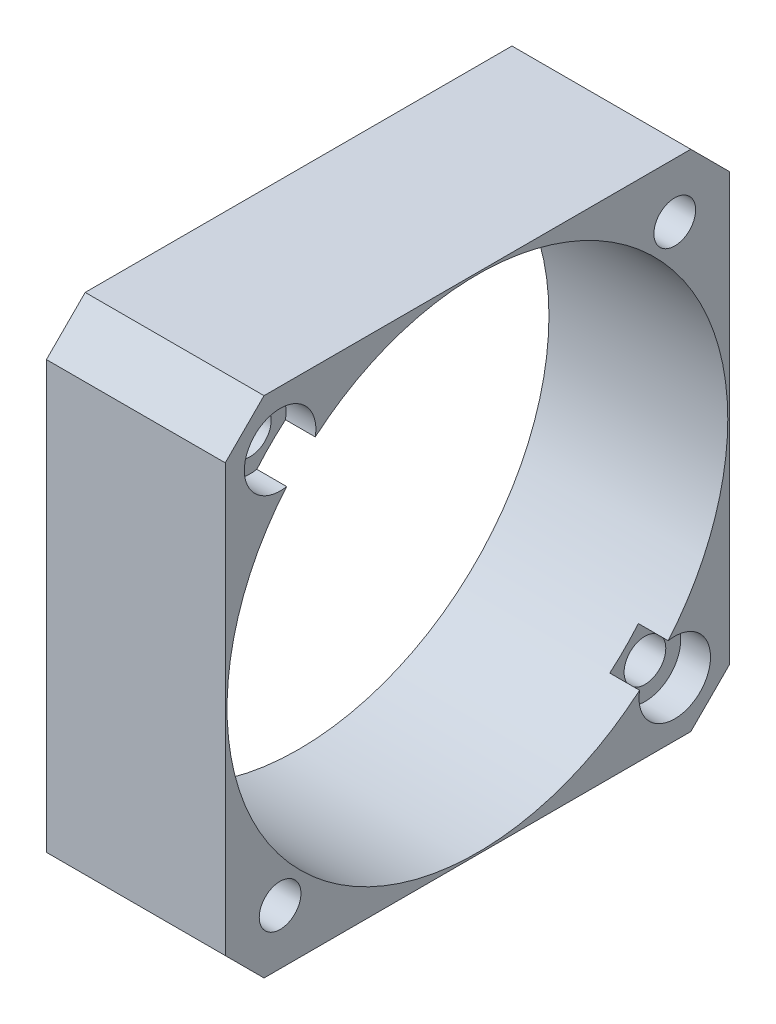
from build123d import *
from build123d.topology import SkipClean

# Parameters (mm, degrees)
BOSS_EXTRUDE1_START     = -10
BOSS_EXTRUDE1_OUTLINE_W = 42.3
BOSS_EXTRUDE1_OUTLINE_H = 42.3
BOSS_EXTRUDE1_DEPTH     = 10
CUT_EXTRUDE1_DEPTH      = 38.645549687
CUT_EXTRUDE1_DEPTH_BACK = 38.645549687
SKETCH2_R               = 1.75
CUT_EXTRUDE2_DEPTH      = 38.645549687
SKETCH4_R               = 18.5
SKETCH4_R_2             = 1.75
BOSS_EXTRUDE2_DEPTH     = 5
SKETCH5_R               = 3
CUT_EXTRUDE3_DEPTH      = 2.5
SKETCH6_R               = 21
CUT_EXTRUDE4_DEPTH      = 40.27069405


with BuildPart() as part:
    # Boss-Extrude1: read off the stored shape, not the designer's step
    # Boss-Extrude1 outline → Boss-Extrude1 (new body)
    with BuildSketch(Plane(origin=(-8.22287786, 0, 0), x_dir=(0, 0, -1), z_dir=(1, 0, 0)).offset(BOSS_EXTRUDE1_START)):
        with Locations((-8.319465315, -0.033437522)):
            Rectangle(BOSS_EXTRUDE1_OUTLINE_W, BOSS_EXTRUDE1_OUTLINE_H)
        with BuildLine():
            ThreePointArc((-8.140312225, 18.091677103), (-7.905501659, 17.531132097), (-7.710167137, 16.95564002))
            ThreePointArc((-7.710167137, 16.95564002), (-7.556763199, 16.949444609), (-7.403421467, 16.941864056))
            ThreePointArc((-7.403421467, 16.941864056), (-7.157286592, 17.497529719), (-6.873174438, 18.034769879))
            ThreePointArc((-6.873174438, 18.034769879), (-6.694663202, 18.019592531), (-6.516310694, 18.002651561))
            ThreePointArc((-6.516310694, 18.002651561), (-6.332692274, 17.423314887), (-6.189730822, 16.832629921))
            ThreePointArc((-6.189730822, 16.832629921), (-6.037499796, 16.812708428), (-5.885454889, 16.791412945))
            ThreePointArc((-5.885454889, 16.791412945), (-5.590501394, 17.322778302), (-5.259375155, 17.832388074))
            ThreePointArc((-5.259375155, 17.832388074), (-5.08294304, 17.801270201), (-4.906827104, 17.768410035))
            ThreePointArc((-4.906827104, 17.768410035), (-4.775879216, 17.174946172), (-4.686441878, 16.573824164))
            ThreePointArc((-4.686441878, 16.573824164), (-4.536609438, 16.540336985), (-4.387085531, 16.505498031))
            ThreePointArc((-4.387085531, 16.505498031), (-4.045688209, 17.008284839), (-3.670213919, 17.486161145))
            ThreePointArc((-3.670213919, 17.486161145), (-3.497281452, 17.439353291), (-3.32482007, 17.390838499))
            ThreePointArc((-3.32482007, 17.390838499), (-3.24759703, 16.788025669), (-3.212403902, 16.181306501))
            ThreePointArc((-3.212403902, 16.181306501), (-3.066176411, 16.134523255), (-2.920377383, 16.086421333))
            ThreePointArc((-2.920377383, 16.086421333), (-2.535284964, 16.556581449), (-2.118485721, 16.998876709))
            ThreePointArc((-2.118485721, 16.998876709), (-1.950445253, 16.936755743), (-1.783026982, 16.872976939))
            ThreePointArc((-1.783026982, 16.872976939), (-1.760150546, 16.265668636), (-1.779484981, 15.658237253))
            ThreePointArc((-1.779484981, 15.658237253), (-1.638039777, 15.598534611), (-1.497139516, 15.537557009))
            ThreePointArc((-1.497139516, 15.537557009), (-1.071452538, 15.971304981), (-0.616684165, 16.374458094))
            ThreePointArc((-0.616684165, 16.374458094), (-0.454888659, 16.297524177), (-0.293861453, 16.21899487))
            ThreePointArc((-0.293861453, 16.21899487), (-0.325515807, 15.612080784), (-0.399222137, 15.008827866))
            ThreePointArc((-0.399222137, 15.008827866), (-0.263698053, 14.936686519), (-0.128831005, 14.863324193))
            ThreePointArc((-0.128831005, 14.863324193), (0.33402315, 15.257167737), (0.823099126, 15.617932752))
            ThreePointArc((0.823099126, 15.617932752), (0.977346988, 15.526805311), (1.130686633, 15.434157772))
            ThreePointArc((1.130686633, 15.434157772), (1.044756351, 14.832524418), (0.917271566, 14.238307003))
            ThreePointArc((0.917271566, 14.238307003), (1.04578337, 14.154307791), (1.173531334, 14.069151411))
            ThreePointArc((1.173531334, 14.069151411), (1.669826038, 14.41991953), (2.189271864, 14.735391778))
            ThreePointArc((2.189271864, 14.735391778), (2.334730168, 14.630804518), (2.479147652, 14.524784691))
            ThreePointArc((2.479147652, 14.524784691), (2.339633302, 13.933276067), (2.159396495, 13.352878445))
            ThreePointArc((2.159396495, 13.352878445), (2.279861317, 13.25769768), (2.399461646, 13.161432875))
            ThreePointArc((2.399461646, 13.161432875), (2.925201025, 13.46630139), (3.47083443, 13.733940875))
            ThreePointArc((3.47083443, 13.733940875), (3.606332032, 13.616735871), (3.740664589, 13.498197365))
            ThreePointArc((3.740664589, 13.498197365), (3.548689459, 12.921575951), (3.31715179, 12.359671142))
            ThreePointArc((3.31715179, 12.359671142), (3.428599718, 12.254075163), (3.539089461, 12.147477001))
            ThreePointArc((3.539089461, 12.147477001), (4.090040571, 12.403991291), (4.657468434, 12.621643137))
            ThreePointArc((4.657468434, 12.621643137), (4.781914387, 12.492764053), (4.905080451, 12.362661271))
            ThreePointArc((4.905080451, 12.362661271), (4.662190211, 11.805569683), (4.381215887, 11.266681815))
            ThreePointArc((4.381215887, 11.266681815), (4.482749607, 11.151520819), (4.583239166, 11.035447566))
            ThreePointArc((4.583239166, 11.035447566), (5.154966072, 11.241542328), (5.739619798, 11.40745413))
            ThreePointArc((5.739619798, 11.40745413), (5.852012136, 11.267938627), (5.963020047, 11.127319079))
            ThreePointArc((5.963020047, 11.127319079), (5.671170307, 10.594242691), (5.343021566, 10.082710571))
            ThreePointArc((5.343021566, 10.082710571), (5.43382359, 9.958911767), (5.52350388, 9.834297976))
            ThreePointArc((5.52350388, 9.834297976), (6.111403374, 9.988313856), (6.708575676, 10.10114979))
            ThreePointArc((6.708575676, 10.10114979), (6.808009482, 9.952121164), (6.905965468, 9.802117037))
            ThreePointArc((6.905965468, 9.802117037), (6.56750603, 9.297347867), (6.194824934, 8.817290051))
            ThreePointArc((6.194824934, 8.817290051), (6.274164177, 8.685850194), (6.352313147, 8.553699182))
            ThreePointArc((6.352313147, 8.553699182), (6.951651807, 8.654396135), (7.556534604, 8.713247712))
            ThreePointArc((7.556534604, 8.713247712), (7.642209296, 8.555905854), (7.726324673, 8.397724892))
            ThreePointArc((7.726324673, 8.397724892), (7.343980614, 7.925327045), (6.929767772, 7.480608677))
            ThreePointArc((6.929767772, 7.480608677), (6.99700544, 7.342586043), (7.06299388, 7.203961813))
            ThreePointArc((7.06299388, 7.203961813), (7.668946184, 7.250529086), (8.276669315, 7.254922468))
            ThreePointArc((8.276669315, 7.254922468), (8.347895091, 7.090534202), (8.417492612, 6.925449986))
            ThreePointArc((8.417492612, 6.925449986), (7.994342341, 6.48922693), (7.541932751, 6.08342862))
            ThreePointArc((7.541932751, 6.08342862), (7.596527486, 5.939934487), (7.649824096, 5.795953159))
            ThreePointArc((7.649824096, 5.795953159), (8.257511273, 5.788015821), (8.863181709, 5.737915635))
            ThreePointArc((8.863181709, 5.737915635), (8.9193851, 5.567804518), (8.973904407, 5.397146209))
            ThreePointArc((8.973904407, 5.397146209), (8.513354882, 5.000610157), (8.026391079, 4.636999155))
            ThreePointArc((8.026391079, 4.636999155), (8.067903317, 4.489188853), (8.108078984, 4.34100968))
            ThreePointArc((8.108078984, 4.34100968), (8.712608293, 4.278631636), (9.311349532, 4.17444126))
            ThreePointArc((9.311349532, 4.17444126), (9.352078022, 3.999976927), (9.391080158, 3.825118565))
            ThreePointArc((9.391080158, 3.825118565), (8.896839451, 3.471462192), (8.379242183, 3.152966079))
            ThreePointArc((8.379242183, 3.152966079), (8.407337692, 3.00202969), (8.434068944, 2.850845724))
            ThreePointArc((8.434068944, 2.850845724), (9.030573071, 2.734529206), (9.617564401, 2.577087519))
            ThreePointArc((9.617564401, 2.577087519), (9.642490067, 2.399674654), (9.665661009, 2.222024096))
            ThreePointArc((9.665661009, 2.222024096), (9.141708458, 1.914094835), (8.597645113, 1.643277956))
            ThreePointArc((8.597645113, 1.643277956), (8.612097683, 1.49043073), (8.625169297, 1.337459215))
            ThreePointArc((8.625169297, 1.337459215), (9.208845542, 1.168140735), (9.779360853, 0.958715365))
            ThreePointArc((9.779360853, 0.958715365), (9.788283009, 0.779782393), (9.795436199, 0.600769976))
            ThreePointArc((9.795436199, 0.600769976), (9.24599036, 0.341047093), (8.679841416, 0.120089905))
            ThreePointArc((8.679841416, 0.120089905), (8.680534685, -0.033437522), (8.679841416, -0.186964949))
            ThreePointArc((8.679841416, -0.186964949), (9.24599036, -0.407922137), (9.795436199, -0.667645021))
            ThreePointArc((9.795436199, -0.667645021), (9.788283009, -0.846657437), (9.779360853, -1.025590409))
            ThreePointArc((9.779360853, -1.025590409), (9.208845542, -1.23501578), (8.625169297, -1.404334259))
            ThreePointArc((8.625169297, -1.404334259), (8.612097683, -1.557305774), (8.597645113, -1.710153))
            ThreePointArc((8.597645113, -1.710153), (9.141708458, -1.980969879), (9.665661009, -2.28889914))
            ThreePointArc((9.665661009, -2.28889914), (9.642490067, -2.466549698), (9.617564401, -2.643962563))
            ThreePointArc((9.617564401, -2.643962563), (9.030573071, -2.80140425), (8.434068944, -2.917720768))
            ThreePointArc((8.434068944, -2.917720768), (8.407337692, -3.068904734), (8.379242183, -3.219841124))
            ThreePointArc((8.379242183, -3.219841124), (8.896839451, -3.538337236), (9.391080158, -3.891993609))
            ThreePointArc((9.391080158, -3.891993609), (9.352078022, -4.066851971), (9.311349532, -4.241316304))
            ThreePointArc((9.311349532, -4.241316304), (8.712608293, -4.34550668), (8.108078984, -4.407884724))
            ThreePointArc((8.108078984, -4.407884724), (8.067903317, -4.556063897), (8.026391079, -4.703874199))
            ThreePointArc((8.026391079, -4.703874199), (8.513354882, -5.067485201), (8.973904407, -5.464021253))
            ThreePointArc((8.973904407, -5.464021253), (8.9193851, -5.634679562), (8.863181709, -5.804790679))
            ThreePointArc((8.863181709, -5.804790679), (8.257511273, -5.854890865), (7.649824096, -5.862828204))
            ThreePointArc((7.649824096, -5.862828204), (7.596527486, -6.006809532), (7.541932751, -6.150303665))
            ThreePointArc((7.541932751, -6.150303665), (7.994342341, -6.556101975), (8.417492612, -6.99232503))
            ThreePointArc((8.417492612, -6.99232503), (8.347895091, -7.157409246), (8.276669315, -7.321797513))
            ThreePointArc((8.276669315, -7.321797513), (7.668946184, -7.31740413), (7.06299388, -7.270836857))
            ThreePointArc((7.06299388, -7.270836857), (6.99700544, -7.409461087), (6.929767772, -7.547483721))
            ThreePointArc((6.929767772, -7.547483721), (7.343980614, -7.992202089), (7.726324673, -8.464599937))
            ThreePointArc((7.726324673, -8.464599937), (7.642209296, -8.622780898), (7.556534604, -8.780122757))
            ThreePointArc((7.556534604, -8.780122757), (6.951651807, -8.721271179), (6.352313147, -8.620574226))
            ThreePointArc((6.352313147, -8.620574226), (6.274164177, -8.752725238), (6.194824934, -8.884165095))
            ThreePointArc((6.194824934, -8.884165095), (6.56750603, -9.364222911), (6.905965468, -9.868992081))
            ThreePointArc((6.905965468, -9.868992081), (6.808009482, -10.018996208), (6.708575676, -10.168024834))
            ThreePointArc((6.708575676, -10.168024834), (6.111403374, -10.0551889), (5.52350388, -9.90117302))
            ThreePointArc((5.52350388, -9.90117302), (5.43382359, -10.025786811), (5.343021566, -10.149585615))
            ThreePointArc((5.343021566, -10.149585615), (5.671170307, -10.661117735), (5.963020047, -11.194194123))
            ThreePointArc((5.963020047, -11.194194123), (5.852012137, -11.334813671), (5.739619798, -11.474329174))
            ThreePointArc((5.739619798, -11.474329174), (5.154966072, -11.308417372), (4.583239166, -11.10232261))
            ThreePointArc((4.583239166, -11.10232261), (4.482749607, -11.218395863), (4.381215887, -11.333556859))
            ThreePointArc((4.381215887, -11.333556859), (4.662190211, -11.872444727), (4.905080451, -12.429536315))
            ThreePointArc((4.905080451, -12.429536315), (4.781914387, -12.559639098), (4.657468434, -12.688518181))
            ThreePointArc((4.657468434, -12.688518181), (4.090040571, -12.470866335), (3.539089461, -12.214352046))
            ThreePointArc((3.539089461, -12.214352046), (3.428599718, -12.320950207), (3.31715179, -12.426546186))
            ThreePointArc((3.31715179, -12.426546186), (3.548689459, -12.988450995), (3.740664589, -13.565072409))
            ThreePointArc((3.740664589, -13.565072409), (3.606332032, -13.683610915), (3.47083443, -13.80081592))
            ThreePointArc((3.47083443, -13.80081592), (2.925201025, -13.533176435), (2.399461646, -13.22830792))
            ThreePointArc((2.399461646, -13.22830792), (2.279861317, -13.324572724), (2.159396495, -13.419753489))
            ThreePointArc((2.159396495, -13.419753489), (2.339633302, -14.000151111), (2.479147652, -14.591659735))
            ThreePointArc((2.479147652, -14.591659735), (2.334730168, -14.697679562), (2.189271864, -14.802266823))
            ThreePointArc((2.189271864, -14.802266823), (1.669826038, -14.486794574), (1.173531334, -14.136026456))
            ThreePointArc((1.173531334, -14.136026456), (1.04578337, -14.221182835), (0.917271566, -14.305182047))
            ThreePointArc((0.917271566, -14.305182047), (1.044756351, -14.899399462), (1.130686633, -15.501032816))
            ThreePointArc((1.130686633, -15.501032816), (0.977346988, -15.593680355), (0.823099126, -15.684807796))
            ThreePointArc((0.823099126, -15.684807796), (0.33402315, -15.324042781), (-0.128831005, -14.930199238))
            ThreePointArc((-0.128831005, -14.930199238), (-0.263698052, -15.003561564), (-0.399222137, -15.07570291))
            ThreePointArc((-0.399222137, -15.07570291), (-0.325515807, -15.678955828), (-0.293861453, -16.285869914))
            ThreePointArc((-0.293861453, -16.285869914), (-0.454888659, -16.364399222), (-0.616684165, -16.441333139))
            ThreePointArc((-0.616684165, -16.441333139), (-1.071452538, -16.038180025), (-1.497139516, -15.604432053))
            ThreePointArc((-1.497139516, -15.604432053), (-1.638039777, -15.665409655), (-1.779484981, -15.725112297))
            ThreePointArc((-1.779484981, -15.725112297), (-1.760150546, -16.33254368), (-1.783026982, -16.939851983))
            ThreePointArc((-1.783026982, -16.939851983), (-1.950445253, -17.003630787), (-2.118485721, -17.065751754))
            ThreePointArc((-2.118485721, -17.065751754), (-2.535284964, -16.623456494), (-2.920377383, -16.153296377))
            ThreePointArc((-2.920377383, -16.153296377), (-3.066176411, -16.201398299), (-3.212403902, -16.248181545))
            ThreePointArc((-3.212403902, -16.248181545), (-3.24759703, -16.854900714), (-3.32482007, -17.457713544))
            ThreePointArc((-3.32482007, -17.457713544), (-3.497281452, -17.506228335), (-3.670213919, -17.553036189))
            ThreePointArc((-3.670213919, -17.553036189), (-4.045688209, -17.075159884), (-4.387085531, -16.572373075))
            ThreePointArc((-4.387085531, -16.572373075), (-4.536609438, -16.607212029), (-4.686441878, -16.640699208))
            ThreePointArc((-4.686441878, -16.640699208), (-4.775879216, -17.241821216), (-4.906827104, -17.835285079))
            ThreePointArc((-4.906827104, -17.835285079), (-5.08294304, -17.868145245), (-5.259375155, -17.899263118))
            ThreePointArc((-5.259375155, -17.899263118), (-5.590501394, -17.389653346), (-5.885454889, -16.858287989))
            ThreePointArc((-5.885454889, -16.858287989), (-6.037499796, -16.879583472), (-6.189730822, -16.899504965))
            ThreePointArc((-6.189730822, -16.899504965), (-6.332692274, -17.490189931), (-6.516310694, -18.069526605))
            ThreePointArc((-6.516310694, -18.069526605), (-6.694663202, -18.086467575), (-6.873174438, -18.101644923))
            ThreePointArc((-6.873174438, -18.101644923), (-7.157286592, -17.564404763), (-7.403421467, -17.0087391))
            ThreePointArc((-7.403421467, -17.0087391), (-7.556763199, -17.016319653), (-7.710167137, -17.022515064))
            ThreePointArc((-7.710167137, -17.022515064), (-7.905501659, -17.598007141), (-8.140312225, -18.158552147))
            ThreePointArc((-8.140312225, -18.158552147), (-8.319465315, -18.159437522), (-8.498618404, -18.158552147))
            ThreePointArc((-8.498618404, -18.158552147), (-8.73342897, -17.598007141), (-8.928763492, -17.022515064))
            ThreePointArc((-8.928763492, -17.022515064), (-9.08216743, -17.016319653), (-9.235509162, -17.0087391))
            ThreePointArc((-9.235509162, -17.0087391), (-9.481644037, -17.564404763), (-9.765756192, -18.101644923))
            ThreePointArc((-9.765756192, -18.101644923), (-9.944267428, -18.086467575), (-10.122619935, -18.069526605))
            ThreePointArc((-10.122619935, -18.069526605), (-10.306238356, -17.490189931), (-10.449199807, -16.899504965))
            ThreePointArc((-10.449199807, -16.899504965), (-10.601430834, -16.879583472), (-10.753475741, -16.858287989))
            ThreePointArc((-10.753475741, -16.858287989), (-11.048429235, -17.389653346), (-11.379555474, -17.899263118))
            ThreePointArc((-11.379555474, -17.899263118), (-11.555987589, -17.868145245), (-11.732103525, -17.835285079))
            ThreePointArc((-11.732103525, -17.835285079), (-11.863051413, -17.241821216), (-11.952488751, -16.640699208))
            ThreePointArc((-11.952488751, -16.640699208), (-12.102321192, -16.607212029), (-12.251845099, -16.572373075))
            ThreePointArc((-12.251845099, -16.572373075), (-12.59324242, -17.075159884), (-12.96871671, -17.553036189))
            ThreePointArc((-12.96871671, -17.553036189), (-13.141649177, -17.506228335), (-13.31411056, -17.457713544))
            ThreePointArc((-13.31411056, -17.457713544), (-13.391333599, -16.854900714), (-13.426526727, -16.248181545))
            ThreePointArc((-13.426526727, -16.248181545), (-13.572754219, -16.201398299), (-13.718553247, -16.153296377))
            ThreePointArc((-13.718553247, -16.153296377), (-14.103645665, -16.623456494), (-14.520444908, -17.065751754))
            ThreePointArc((-14.520444908, -17.065751754), (-14.688485376, -17.003630787), (-14.855903647, -16.939851983))
            ThreePointArc((-14.855903647, -16.939851983), (-14.878780084, -16.33254368), (-14.859445648, -15.725112297))
            ThreePointArc((-14.859445648, -15.725112297), (-15.000890853, -15.665409655), (-15.141791113, -15.604432053))
            ThreePointArc((-15.141791113, -15.604432053), (-15.567478091, -16.038180025), (-16.022246464, -16.441333139))
            ThreePointArc((-16.022246464, -16.441333139), (-16.18404197, -16.364399222), (-16.345069176, -16.285869914))
            ThreePointArc((-16.345069176, -16.285869914), (-16.313414823, -15.678955828), (-16.239708492, -15.07570291))
            ThreePointArc((-16.239708492, -15.07570291), (-16.375232577, -15.003561564), (-16.510099624, -14.930199238))
            ThreePointArc((-16.510099624, -14.930199238), (-16.97295378, -15.324042781), (-17.462029755, -15.684807796))
            ThreePointArc((-17.462029755, -15.684807796), (-17.616277617, -15.593680355), (-17.769617262, -15.501032816))
            ThreePointArc((-17.769617262, -15.501032816), (-17.68368698, -14.899399462), (-17.556202195, -14.305182047))
            ThreePointArc((-17.556202195, -14.305182047), (-17.684713999, -14.221182835), (-17.812461963, -14.136026456))
            ThreePointArc((-17.812461963, -14.136026456), (-18.308756667, -14.486794574), (-18.828202493, -14.802266823))
            ThreePointArc((-18.828202493, -14.802266823), (-18.973660797, -14.697679562), (-19.118078281, -14.591659735))
            ThreePointArc((-19.118078281, -14.591659735), (-18.978563932, -14.000151111), (-18.798327124, -13.419753489))
            ThreePointArc((-18.798327124, -13.419753489), (-18.918791946, -13.324572724), (-19.038392276, -13.22830792))
            ThreePointArc((-19.038392276, -13.22830792), (-19.564131655, -13.533176435), (-20.109765059, -13.80081592))
            ThreePointArc((-20.109765059, -13.80081592), (-20.245262661, -13.683610915), (-20.379595218, -13.565072409))
            ThreePointArc((-20.379595218, -13.565072409), (-20.187620088, -12.988450995), (-19.956082419, -12.426546186))
            ThreePointArc((-19.956082419, -12.426546186), (-20.067530347, -12.320950207), (-20.17802009, -12.214352046))
            ThreePointArc((-20.17802009, -12.214352046), (-20.7289712, -12.470866335), (-21.296399063, -12.688518181))
            ThreePointArc((-21.296399063, -12.688518181), (-21.420845016, -12.559639098), (-21.54401108, -12.429536315))
            ThreePointArc((-21.54401108, -12.429536315), (-21.301120841, -11.872444727), (-21.020146516, -11.333556859))
            ThreePointArc((-21.020146516, -11.333556859), (-21.121680237, -11.218395863), (-21.222169795, -11.10232261))
            ThreePointArc((-21.222169795, -11.10232261), (-21.793896701, -11.308417372), (-22.378550428, -11.474329174))
            ThreePointArc((-22.378550428, -11.474329174), (-22.490942766, -11.334813671), (-22.601950676, -11.194194123))
            ThreePointArc((-22.601950676, -11.194194123), (-22.310100936, -10.661117735), (-21.981952195, -10.149585615))
            ThreePointArc((-21.981952195, -10.149585615), (-22.072754219, -10.025786811), (-22.16243451, -9.90117302))
            ThreePointArc((-22.16243451, -9.90117302), (-22.750334003, -10.0551889), (-23.347506305, -10.168024834))
            ThreePointArc((-23.347506305, -10.168024834), (-23.446940112, -10.018996208), (-23.544896097, -9.868992081))
            ThreePointArc((-23.544896097, -9.868992081), (-23.20643666, -9.364222911), (-22.833755564, -8.884165095))
            ThreePointArc((-22.833755564, -8.884165095), (-22.913094806, -8.752725238), (-22.991243776, -8.620574226))
            ThreePointArc((-22.991243776, -8.620574226), (-23.590582436, -8.721271179), (-24.195465233, -8.780122757))
            ThreePointArc((-24.195465233, -8.780122757), (-24.281139925, -8.622780898), (-24.365255303, -8.464599937))
            ThreePointArc((-24.365255303, -8.464599937), (-23.982911244, -7.992202089), (-23.568698401, -7.547483721))
            ThreePointArc((-23.568698401, -7.547483721), (-23.635936069, -7.409461087), (-23.701924509, -7.270836857))
            ThreePointArc((-23.701924509, -7.270836857), (-24.307876813, -7.31740413), (-24.915599944, -7.321797513))
            ThreePointArc((-24.915599944, -7.321797513), (-24.98682572, -7.157409246), (-25.056423242, -6.99232503))
            ThreePointArc((-25.056423242, -6.99232503), (-24.633272971, -6.556101975), (-24.18086338, -6.150303665))
            ThreePointArc((-24.18086338, -6.150303665), (-24.235458116, -6.006809532), (-24.288754725, -5.862828204))
            ThreePointArc((-24.288754725, -5.862828204), (-24.896441902, -5.854890865), (-25.502112338, -5.804790679))
            ThreePointArc((-25.502112338, -5.804790679), (-25.558315729, -5.634679562), (-25.612835037, -5.464021253))
            ThreePointArc((-25.612835037, -5.464021253), (-25.152285511, -5.067485201), (-24.665321708, -4.703874199))
            ThreePointArc((-24.665321708, -4.703874199), (-24.706833946, -4.556063897), (-24.747009613, -4.407884724))
            ThreePointArc((-24.747009613, -4.407884724), (-25.351538922, -4.34550668), (-25.950280161, -4.241316304))
            ThreePointArc((-25.950280161, -4.241316304), (-25.991008651, -4.066851971), (-26.030010787, -3.891993609))
            ThreePointArc((-26.030010787, -3.891993609), (-25.535770081, -3.538337236), (-25.018172812, -3.219841124))
            ThreePointArc((-25.018172812, -3.219841124), (-25.046268321, -3.068904734), (-25.072999573, -2.917720768))
            ThreePointArc((-25.072999573, -2.917720768), (-25.6695037, -2.80140425), (-26.25649503, -2.643962563))
            ThreePointArc((-26.25649503, -2.643962563), (-26.281420696, -2.466549698), (-26.304591639, -2.28889914))
            ThreePointArc((-26.304591639, -2.28889914), (-25.780639087, -1.980969879), (-25.236575742, -1.710153))
            ThreePointArc((-25.236575742, -1.710153), (-25.251028313, -1.557305774), (-25.264099927, -1.404334259))
            ThreePointArc((-25.264099927, -1.404334259), (-25.847776171, -1.23501578), (-26.418291482, -1.025590409))
            ThreePointArc((-26.418291482, -1.025590409), (-26.427213639, -0.846657437), (-26.434366828, -0.667645021))
            ThreePointArc((-26.434366828, -0.667645021), (-25.884920989, -0.407922137), (-25.318772045, -0.186964949))
            ThreePointArc((-25.318772045, -0.186964949), (-25.319465315, -0.033437522), (-25.318772045, 0.120089905))
            ThreePointArc((-25.318772045, 0.120089905), (-25.884920989, 0.341047093), (-26.434366828, 0.600769976))
            ThreePointArc((-26.434366828, 0.600769976), (-26.427213639, 0.779782393), (-26.418291482, 0.958715365))
            ThreePointArc((-26.418291482, 0.958715365), (-25.847776171, 1.168140735), (-25.264099927, 1.337459215))
            ThreePointArc((-25.264099927, 1.337459215), (-25.251028313, 1.49043073), (-25.236575742, 1.643277956))
            ThreePointArc((-25.236575742, 1.643277956), (-25.780639087, 1.914094835), (-26.304591639, 2.222024096))
            ThreePointArc((-26.304591639, 2.222024096), (-26.281420696, 2.399674654), (-26.25649503, 2.577087519))
            ThreePointArc((-26.25649503, 2.577087519), (-25.6695037, 2.734529206), (-25.072999573, 2.850845724))
            ThreePointArc((-25.072999573, 2.850845724), (-25.046268321, 3.00202969), (-25.018172812, 3.152966079))
            ThreePointArc((-25.018172812, 3.152966079), (-25.535770081, 3.471462192), (-26.030010787, 3.825118565))
            ThreePointArc((-26.030010787, 3.825118565), (-25.991008651, 3.999976927), (-25.950280161, 4.17444126))
            ThreePointArc((-25.950280161, 4.17444126), (-25.351538922, 4.278631636), (-24.747009613, 4.34100968))
            ThreePointArc((-24.747009613, 4.34100968), (-24.706833946, 4.489188853), (-24.665321708, 4.636999155))
            ThreePointArc((-24.665321708, 4.636999155), (-25.152285511, 5.000610157), (-25.612835037, 5.397146209))
            ThreePointArc((-25.612835037, 5.397146209), (-25.558315729, 5.567804518), (-25.502112338, 5.737915635))
            ThreePointArc((-25.502112338, 5.737915635), (-24.896441902, 5.788015821), (-24.288754725, 5.795953159))
            ThreePointArc((-24.288754725, 5.795953159), (-24.235458116, 5.939934487), (-24.18086338, 6.08342862))
            ThreePointArc((-24.18086338, 6.08342862), (-24.633272971, 6.48922693), (-25.056423242, 6.925449986))
            ThreePointArc((-25.056423242, 6.925449986), (-24.98682572, 7.090534202), (-24.915599944, 7.254922468))
            ThreePointArc((-24.915599944, 7.254922468), (-24.307876813, 7.250529086), (-23.701924509, 7.203961813))
            ThreePointArc((-23.701924509, 7.203961813), (-23.635936069, 7.342586043), (-23.568698401, 7.480608677))
            ThreePointArc((-23.568698401, 7.480608677), (-23.982911244, 7.925327045), (-24.365255303, 8.397724892))
            ThreePointArc((-24.365255303, 8.397724892), (-24.281139925, 8.555905853), (-24.195465233, 8.713247712))
            ThreePointArc((-24.195465233, 8.713247712), (-23.590582436, 8.654396135), (-22.991243776, 8.553699182))
            ThreePointArc((-22.991243776, 8.553699182), (-22.913094806, 8.685850194), (-22.833755564, 8.817290051))
            ThreePointArc((-22.833755564, 8.817290051), (-23.20643666, 9.297347867), (-23.544896097, 9.802117037))
            ThreePointArc((-23.544896097, 9.802117037), (-23.446940112, 9.952121164), (-23.347506305, 10.10114979))
            ThreePointArc((-23.347506305, 10.10114979), (-22.750334003, 9.988313856), (-22.16243451, 9.834297976))
            ThreePointArc((-22.16243451, 9.834297976), (-22.072754219, 9.958911767), (-21.981952195, 10.082710571))
            ThreePointArc((-21.981952195, 10.082710571), (-22.310100936, 10.594242691), (-22.601950676, 11.127319079))
            ThreePointArc((-22.601950676, 11.127319079), (-22.490942766, 11.267938626), (-22.378550428, 11.40745413))
            ThreePointArc((-22.378550428, 11.40745413), (-21.793896701, 11.241542328), (-21.222169795, 11.035447566))
            ThreePointArc((-21.222169795, 11.035447566), (-21.121680237, 11.151520819), (-21.020146516, 11.266681815))
            ThreePointArc((-21.020146516, 11.266681815), (-21.301120841, 11.805569683), (-21.54401108, 12.362661271))
            ThreePointArc((-21.54401108, 12.362661271), (-21.420845016, 12.492764053), (-21.296399063, 12.621643137))
            ThreePointArc((-21.296399063, 12.621643137), (-20.7289712, 12.403991291), (-20.17802009, 12.147477001))
            ThreePointArc((-20.17802009, 12.147477001), (-20.067530347, 12.254075163), (-19.956082419, 12.359671142))
            ThreePointArc((-19.956082419, 12.359671142), (-20.187620088, 12.921575951), (-20.379595218, 13.498197365))
            ThreePointArc((-20.379595218, 13.498197365), (-20.245262661, 13.616735871), (-20.109765059, 13.733940875))
            ThreePointArc((-20.109765059, 13.733940875), (-19.564131655, 13.46630139), (-19.038392276, 13.161432875))
            ThreePointArc((-19.038392276, 13.161432875), (-18.918791946, 13.25769768), (-18.798327124, 13.352878445))
            ThreePointArc((-18.798327124, 13.352878445), (-18.978563932, 13.933276067), (-19.118078281, 14.524784691))
            ThreePointArc((-19.118078281, 14.524784691), (-18.973660798, 14.630804518), (-18.828202493, 14.735391778))
            ThreePointArc((-18.828202493, 14.735391778), (-18.308756667, 14.41991953), (-17.812461963, 14.069151411))
            ThreePointArc((-17.812461963, 14.069151411), (-17.684713999, 14.154307791), (-17.556202195, 14.238307003))
            ThreePointArc((-17.556202195, 14.238307003), (-17.683686981, 14.832524418), (-17.769617262, 15.434157772))
            ThreePointArc((-17.769617262, 15.434157772), (-17.616277617, 15.526805311), (-17.462029755, 15.617932752))
            ThreePointArc((-17.462029755, 15.617932752), (-16.97295378, 15.257167737), (-16.510099624, 14.863324193))
            ThreePointArc((-16.510099624, 14.863324193), (-16.375232577, 14.936686519), (-16.239708492, 15.008827866))
            ThreePointArc((-16.239708492, 15.008827866), (-16.313414823, 15.612080784), (-16.345069176, 16.21899487))
            ThreePointArc((-16.345069176, 16.21899487), (-16.18404197, 16.297524177), (-16.022246464, 16.374458094))
            ThreePointArc((-16.022246464, 16.374458094), (-15.567478091, 15.971304981), (-15.141791113, 15.537557009))
            ThreePointArc((-15.141791113, 15.537557009), (-15.000890853, 15.598534611), (-14.859445648, 15.658237253))
            ThreePointArc((-14.859445648, 15.658237253), (-14.878780084, 16.265668636), (-14.855903647, 16.872976939))
            ThreePointArc((-14.855903647, 16.872976939), (-14.688485376, 16.936755743), (-14.520444908, 16.998876709))
            ThreePointArc((-14.520444908, 16.998876709), (-14.103645665, 16.556581449), (-13.718553247, 16.086421333))
            ThreePointArc((-13.718553247, 16.086421333), (-13.572754219, 16.134523255), (-13.426526727, 16.181306501))
            ThreePointArc((-13.426526727, 16.181306501), (-13.391333599, 16.788025669), (-13.31411056, 17.390838499))
            ThreePointArc((-13.31411056, 17.390838499), (-13.141649177, 17.439353291), (-12.96871671, 17.486161145))
            ThreePointArc((-12.96871671, 17.486161145), (-12.59324242, 17.008284839), (-12.251845099, 16.505498031))
            ThreePointArc((-12.251845099, 16.505498031), (-12.102321192, 16.540336985), (-11.952488751, 16.573824164))
            ThreePointArc((-11.952488751, 16.573824164), (-11.863051413, 17.174946172), (-11.732103525, 17.768410035))
            ThreePointArc((-11.732103525, 17.768410035), (-11.555987589, 17.801270201), (-11.379555474, 17.832388074))
            ThreePointArc((-11.379555474, 17.832388074), (-11.048429235, 17.322778302), (-10.753475741, 16.791412945))
            ThreePointArc((-10.753475741, 16.791412945), (-10.601430834, 16.812708428), (-10.449199807, 16.832629921))
            ThreePointArc((-10.449199807, 16.832629921), (-10.306238356, 17.423314887), (-10.122619935, 18.002651561))
            ThreePointArc((-10.122619935, 18.002651561), (-9.944267428, 18.019592531), (-9.765756192, 18.034769879))
            ThreePointArc((-9.765756192, 18.034769879), (-9.481644037, 17.497529719), (-9.235509162, 16.941864056))
            ThreePointArc((-9.235509162, 16.941864056), (-9.08216743, 16.949444609), (-8.928763492, 16.95564002))
            ThreePointArc((-8.928763492, 16.95564002), (-8.73342897, 17.531132097), (-8.498618404, 18.091677103))
            ThreePointArc((-8.498618404, 18.091677103), (-8.319465315, 18.092562478), (-8.140312225, 18.091677103))
        make_face(mode=Mode.SUBTRACT)
    extrude(amount=BOSS_EXTRUDE1_DEPTH)

    # Sketch2 → Cut-Extrude1 (cut, two sides: drawn at the far end of the back side and taken through both)
    with BuildSketch(Plane(origin=(-8.22287786, 0, 0), x_dir=(0, 0, -1), z_dir=(1, 0, 0)).offset(-CUT_EXTRUDE1_DEPTH_BACK)):
        with Locations((-24.869465315, 16.516562478)):
            Circle(SKETCH2_R)
        with Locations((8.230534685, 16.516562478)):
            Circle(SKETCH2_R)
        with Locations((8.230534685, -16.583437522)):
            Circle(SKETCH2_R)
        with Locations((-24.869465315, -16.583437522)):
            Circle(SKETCH2_R)
    extrude(amount=CUT_EXTRUDE1_DEPTH + CUT_EXTRUDE1_DEPTH_BACK, mode=Mode.SUBTRACT)

    # Sketch3 → Cut-Extrude2 (cut, through all)
    with BuildSketch(Plane(origin=(-8.22287786, 0, 0), x_dir=(0, 0, -1), z_dir=(1, 0, 0))):
        Polygon((9.577843492, -21.183437522), (12.830534685, -17.930746329), (12.830534685, -21.183437522), align=None)
        Polygon((-29.469465315, -17.930746329), (-26.216774121, -21.183437522), (-29.469465315, -21.183437522), align=None)
        Polygon((-26.216774121, 21.116562478), (-29.469465315, 17.863871284), (-29.469465315, 21.116562478), align=None)
        Polygon((12.830534685, 17.863871284), (9.577843492, 21.116562478), (12.830534685, 21.116562478), align=None)
    extrude(amount=-CUT_EXTRUDE2_DEPTH, mode=Mode.SUBTRACT)

    # Sketch4 → Boss-Extrude2 (add)
    with SkipClean():  # the faces are left unmerged after this step: merging them gives an invalid solid
        with BuildSketch(Plane.ZY.offset(18.22287786)):
            Polygon((-12.830534685, 17.863871284), (-12.830534685, -17.930746329), (-9.577843492, -21.183437522), (26.216774121, -21.183437522), (29.469465315, -17.930746329), (29.469465315, 17.863871284), (26.216774121, 21.116562478), (-9.577843492, 21.116562478), align=None)
            with Locations((8.319465315, -0.033437522)):
                Circle(SKETCH4_R, mode=Mode.SUBTRACT)
            with Locations((-8.230534685, 16.516562478)):
                Circle(SKETCH4_R_2, mode=Mode.SUBTRACT)
            with Locations((-8.230534685, -16.583437522)):
                Circle(SKETCH4_R_2, mode=Mode.SUBTRACT)
            with Locations((24.869465315, -16.583437522)):
                Circle(SKETCH4_R_2, mode=Mode.SUBTRACT)
            with Locations((24.869465315, 16.516562478)):
                Circle(SKETCH4_R_2, mode=Mode.SUBTRACT)
        extrude(amount=BOSS_EXTRUDE2_DEPTH)

    # Sketch5 → Cut-Extrude3 (cut)
    with SkipClean():  # the faces are left unmerged after this step: merging them gives an invalid solid
        with BuildSketch(Plane(origin=(-8.22287786, 0, 0), x_dir=(0, 0, -1), z_dir=(1, 0, 0))):
            with Locations((-24.869465315, 16.516562478)):
                Circle(SKETCH5_R)
            with Locations((8.230534685, -16.583437522)):
                Circle(SKETCH5_R)
        extrude(amount=-CUT_EXTRUDE3_DEPTH, mode=Mode.SUBTRACT)

    # Sketch6 → Cut-Extrude4 (cut, through all)
    with SkipClean():  # the faces are left unmerged after this step: merging them gives an invalid solid
        with BuildSketch(Plane(origin=(-8.22287786, 0, 0), x_dir=(0, 0, -1), z_dir=(1, 0, 0))):
            with Locations((-8.319465315, -0.033437522)):
                Circle(SKETCH6_R)
        extrude(amount=-CUT_EXTRUDE4_DEPTH, mode=Mode.SUBTRACT)


solid = part.part
